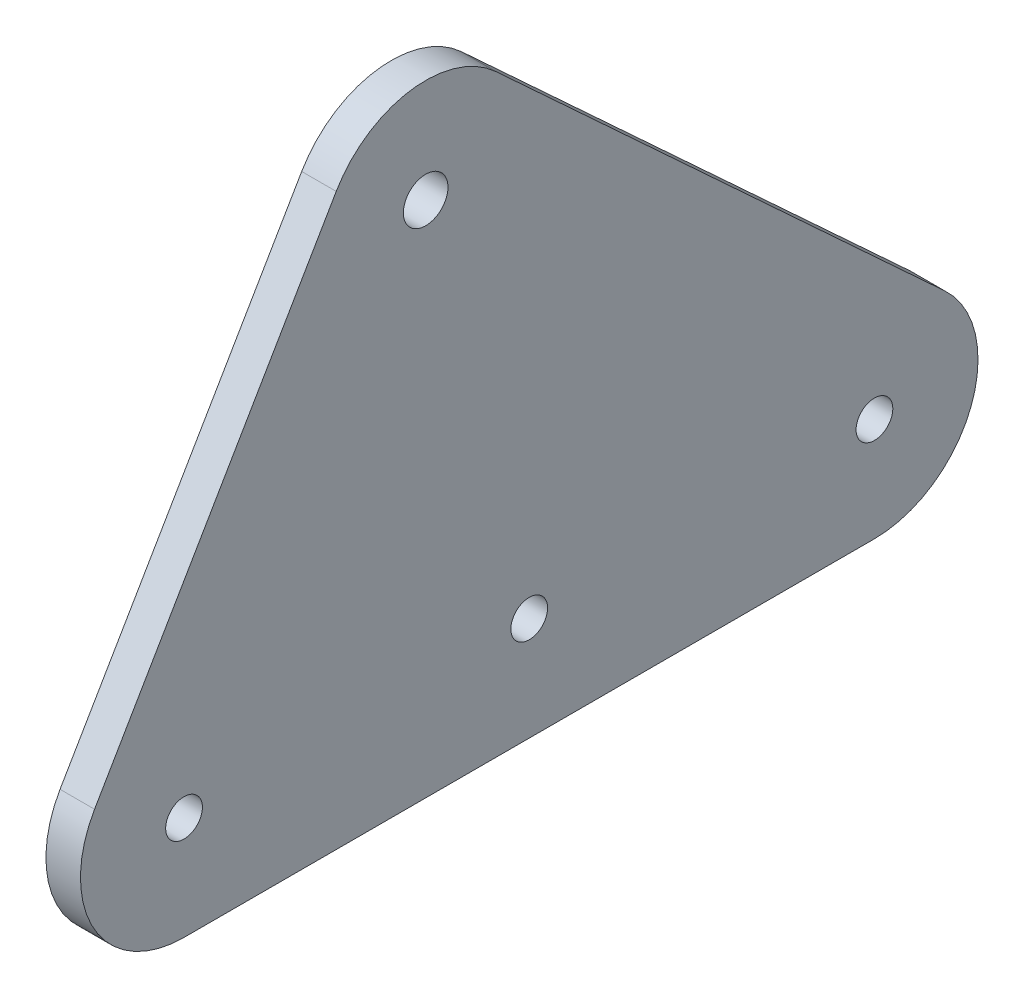
from build123d import *

# Parameters (mm, degrees)
BOSS_EXTRUDE1_DEPTH = 6.35
CUT_EXTRUDE1_REACH  = 141.411
SKETCH2_R           = 3.3782
SKETCH2_R_2         = 4.1021


with BuildPart() as part:
    # Sketch1 → Boss-Extrude1 (new body)
    with BuildSketch(Plane(origin=(0, 0, 0), x_dir=(0, 0, -1), z_dir=(1, 0, 0))):
        with BuildLine():
            Line((-60.904988062, -66.601256964), (-16.454988062, 9.598743036))
            ThreePointArc((-16.454988062, 9.598743036), (-2.821387745, 18.839911656), (12.921235957, 13.99800562))
            Line((12.921235957, 13.99800562), (95.471235957, -62.20199438))
            ThreePointArc((95.471235957, -62.20199438), (100.292103977, -83.136875843), (82.55, -95.25))
            Line((82.55, -95.25), (-44.45, -95.25))
            ThreePointArc((-44.45, -95.25), (-60.969058006, -85.688056839), (-60.904988062, -66.601256964))
        make_face()
    extrude(amount=BOSS_EXTRUDE1_DEPTH)

    # Sketch2 → Cut-Extrude1 (cut, up to next)
    with BuildSketch(Plane(origin=(6.35, 0, 0), x_dir=(0, 0, -1), z_dir=(1, 0, 0)), mode=Mode.PRIVATE) as cut_extrude1_sk1:
        with Locations((-44.45, -76.2)):
            Circle(SKETCH2_R)
    cut_extrude1_tool1 = extrude(cut_extrude1_sk1.sketch, amount=-CUT_EXTRUDE1_REACH, mode=Mode.PRIVATE) & part.part
    # Sketch2 → Cut-Extrude1 (cut, up to next)
    with BuildSketch(Plane(origin=(6.35, 0, 0), x_dir=(0, 0, -1), z_dir=(1, 0, 0)), mode=Mode.PRIVATE) as cut_extrude1_sk2:
        with Locations((19.05, -76.2)):
            Circle(SKETCH2_R)
    cut_extrude1_tool2 = extrude(cut_extrude1_sk2.sketch, amount=-CUT_EXTRUDE1_REACH, mode=Mode.PRIVATE) & part.part
    # Sketch2 → Cut-Extrude1 (cut, up to next)
    with BuildSketch(Plane(origin=(6.35, 0, 0), x_dir=(0, 0, -1), z_dir=(1, 0, 0)), mode=Mode.PRIVATE) as cut_extrude1_sk3:
        with Locations((82.55, -76.2)):
            Circle(SKETCH2_R)
    cut_extrude1_tool3 = extrude(cut_extrude1_sk3.sketch, amount=-CUT_EXTRUDE1_REACH, mode=Mode.PRIVATE) & part.part
    # Sketch2 → Cut-Extrude1 (cut, up to next)
    with BuildSketch(Plane(origin=(6.35, 0, 0), x_dir=(0, 0, -1), z_dir=(1, 0, 0)), mode=Mode.PRIVATE) as cut_extrude1_sk4:
        Circle(SKETCH2_R_2)
    cut_extrude1_tool4 = extrude(cut_extrude1_sk4.sketch, amount=-CUT_EXTRUDE1_REACH, mode=Mode.PRIVATE) & part.part
    add(cut_extrude1_tool1.solids().sort_by_distance((6.35, -76.2, 44.45))[0], mode=Mode.SUBTRACT)
    add(cut_extrude1_tool2.solids().sort_by_distance((6.35, -76.2, -19.05))[0], mode=Mode.SUBTRACT)
    add(cut_extrude1_tool3.solids().sort_by_distance((6.35, -76.2, -82.55))[0], mode=Mode.SUBTRACT)
    add(cut_extrude1_tool4.solids().sort_by_distance((6.35, 0, 0))[0], mode=Mode.SUBTRACT)


solid = part.part
